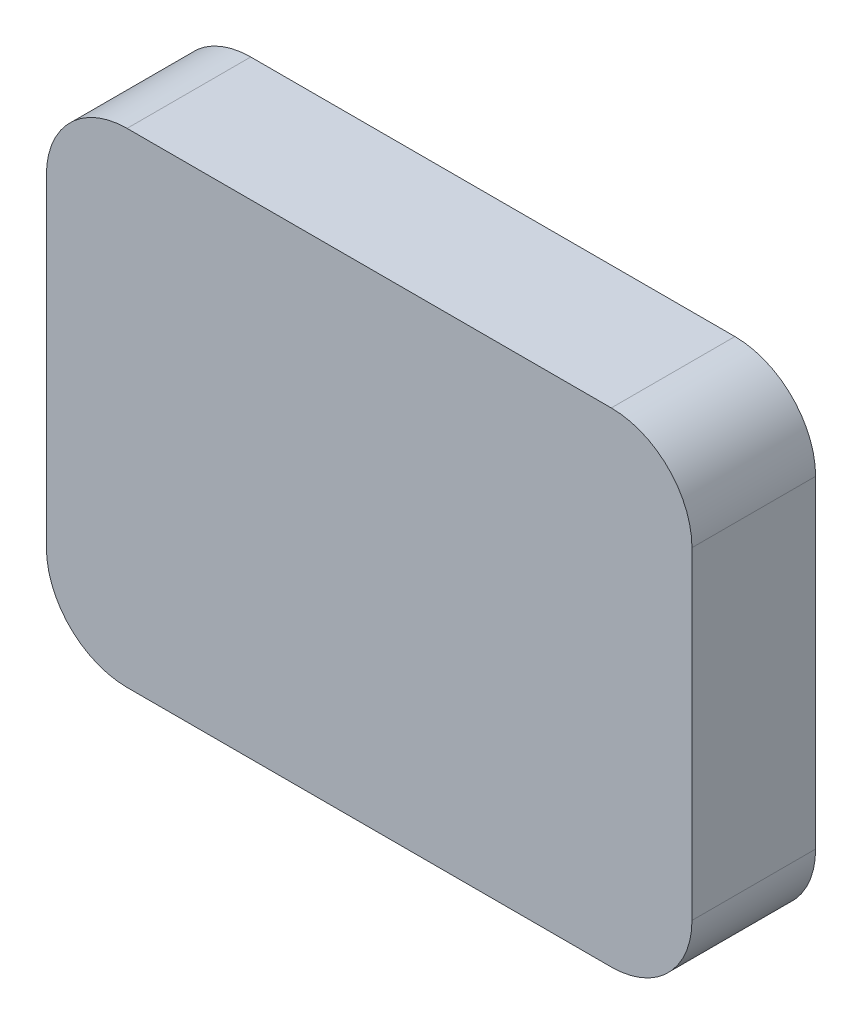
from build123d import *

# Parameters (mm, degrees)
BOSS_EXTRU_1_DEPTH = 1.2
CONG_1_R           = 2


with BuildPart() as part:
    # Balayage1: sweep along a path in Esquisse1
    with BuildLine(Plane.XY) as balayage1_path:
        Line((-30, 30), (30, 30))
        ThreePointArc((30, 30), (37.071067812, 27.071067812), (40, 20))
        Line((40, 20), (40, -20))
        ThreePointArc((40, -20), (37.071067812, -27.071067812), (30, -30))
        Line((30, -30), (-30, -30))
        ThreePointArc((-30, -30), (-37.071067812, -27.071067812), (-40, -20))
        Line((-40, -20), (-40, 20))
        ThreePointArc((-40, 20), (-37.071067812, 27.071067812), (-30, 30))
    # profil → Balayage1 (sweep)
    with BuildSketch(Plane(origin=(0, 0, 0), x_dir=(0, 0, -1), z_dir=(1, 0, 0))):
        with BuildLine():
            Line((0, -27.9), (4.139133187, -27.9))
            Line((4.139133187, -27.9), (14.1228, -23.8))
            Line((14.1228, -23.8), (14.1228, -25.9))
            ThreePointArc((14.1228, -25.9), (15.1228, -26.9), (14.1228, -27.9))
            Line((14.1228, -27.9), (14.1228, -30))
            Line((14.1228, -30), (0, -30))
            Line((0, -30), (0, -27.9))
        make_face()
    sweep(path=balayage1_path.line)

    # Esquisse1<3> → Boss.-Extru.1 (add)
    with BuildSketch(Plane.XY):
        with BuildLine():
            Line((-30, 30), (30, 30))
            ThreePointArc((30, 30), (37.071067812, 27.071067812), (40, 20))
            Line((40, 20), (40, -20))
            ThreePointArc((40, -20), (37.071067812, -27.071067812), (30, -30))
            Line((30, -30), (-30, -30))
            ThreePointArc((-30, -30), (-37.071067812, -27.071067812), (-40, -20))
            Line((-40, -20), (-40, 20))
            ThreePointArc((-40, 20), (-37.071067812, 27.071067812), (-30, 30))
        make_face()
    extrude(amount=BOSS_EXTRU_1_DEPTH)

    # Congé1
    cong_1_edges = [part.edges().sort_by_distance(p)[0] for p in [
        (-35.586143571, 25.586143571, 0),
        (-37.9, 0, 0),
        (-35.586143571, -25.586143571, 0),
        (0, -27.9, 0),
        (0, -27.9, 0),
        (35.586143571, -25.586143571, 0),
        (37.9, 0, 0),
        (35.586143571, 25.586143571, 0),
        (0, 27.9, 0),
    ]]
    fillet(cong_1_edges, radius=CONG_1_R)


solid = part.part
